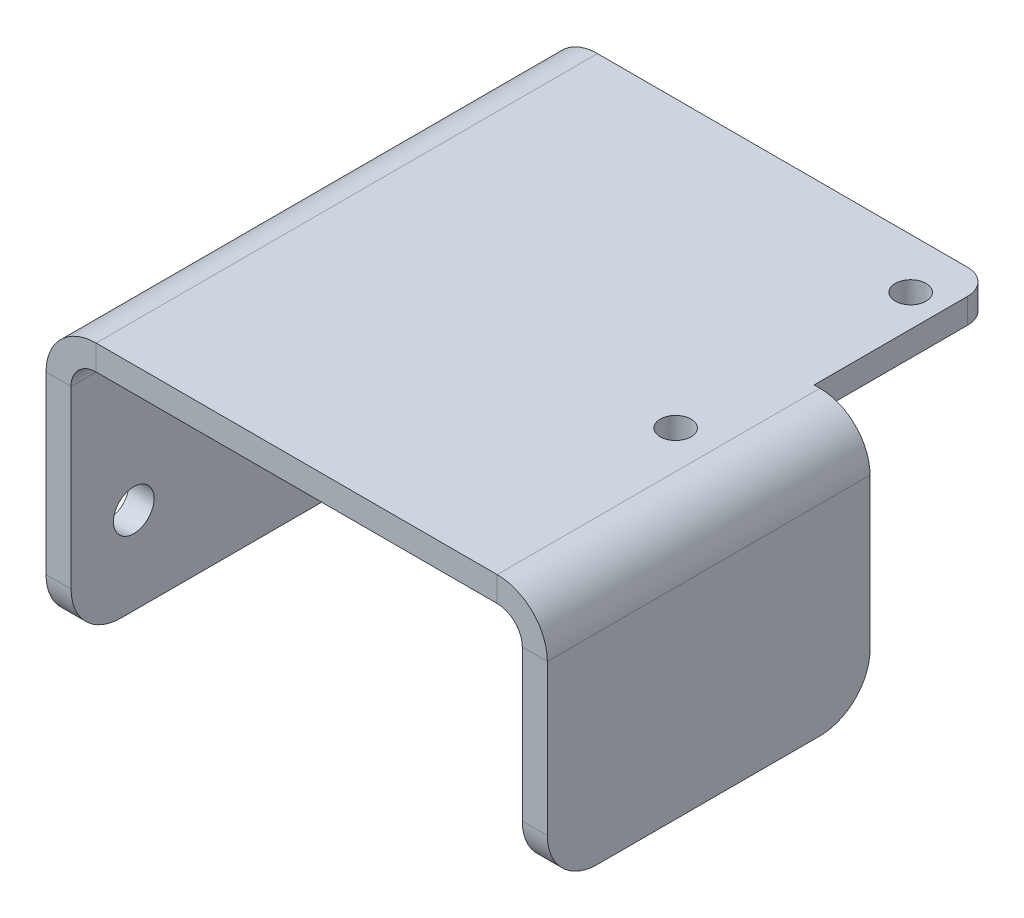
from build123d import *

# Parameters (mm, degrees)
BOSS_EXTRUDE1_DEPTH        = 2
M2_CLEARANCE_HOLE1_D       = 2.459
M3_CLEARANCE_HOLE1_D       = 3.242
SKETCHED_START             = 39.700827994
SKETCHED_BEND1_OUTLINE_W   = 2
SKETCHED_BEND1_OUTLINE_H   = 25.75
SKETCHED_BEND1_DEPTH       = 17.149172006
SKETCHED_START_2           = 36.111787994
SKETCHED_BEND1_2_DEPTH     = 4
SKETCHED_START_3           = -5.75
SKETCHED_BEND1_3_DEPTH     = 25.75
SKETCHED_START_4           = -18.6
SKETCHED_BEND2_OUTLINE_W   = 2
SKETCHED_BEND2_OUTLINE_H   = 40
SKETCHED_BEND2_DEPTH       = 19.122747994
SKETCHED_START_5           = 0.752486697
SKETCHED_BEND2_2_OUTLINE_R = 1.621
SKETCHED_BEND2_2_DEPTH     = 1.359301297
SKETCHED_START_6           = 0.111787994
SKETCHED_BEND2_3_OUTLINE_R = 1.621
SKETCHED_BEND2_3_DEPTH     = 4
SKETCHED_START_7           = -20
SKETCHED_BEND2_4_DEPTH     = 40


with BuildPart() as part:
    # Sketch7 → Boss-Extrude1 (new body)
    with BuildSketch(Plane.XZ):
        with BuildLine():
            Line((35.65, -5.75), (52.85, -5.75))
            ThreePointArc((52.85, -5.75), (55.678427125, -4.578427125), (56.85, -1.75))
            Line((56.85, -1.75), (56.85, 16))
            ThreePointArc((56.85, 16), (55.678427125, 18.828427125), (52.85, 20))
            Line((52.85, 20), (-14.6, 20))
            ThreePointArc((-14.6, 20), (-17.428427125, 18.828427125), (-18.6, 16))
            Line((-18.6, 16), (-18.6, -16))
            ThreePointArc((-18.6, -16), (-17.428427125, -18.828427125), (-14.6, -20))
            Line((-14.6, -20), (33.65, -20))
            ThreePointArc((33.65, -20), (35.064213562, -19.414213562), (35.65, -18))
            Line((35.65, -18), (35.65, -5.75))
        make_face()
    extrude(amount=-BOSS_EXTRUDE1_DEPTH)

    # M2 Clearance Hole1 (through all)
    with Locations(Plane(origin=(0, 0, 0), x_dir=(-1, 0, 0), z_dir=(0, -1, 0))):
        with Locations((-33.1, 16), (-33.1, -2.75)):
            Hole(M2_CLEARANCE_HOLE1_D / 2)

    # M3 Clearance Hole1 (through all)
    with Locations(Plane(origin=(0, 2, 0), x_dir=(1, 0, 0), z_dir=(0, 1, 0))):
        with Locations((-11.65, -15), (-11.65, 15)):
            Hole(M3_CLEARANCE_HOLE1_D / 2)

    # Sketched Bend1: read off the stored shape, not the designer's step
    # Sketched Bend1 outline → Sketched Bend1 (cut)
    with BuildSketch(Plane.YZ.offset(SKETCHED_START)):
        with Locations((1, 7.125)):
            Rectangle(SKETCHED_BEND1_OUTLINE_W, SKETCHED_BEND1_OUTLINE_H)
    extrude(amount=SKETCHED_BEND1_DEPTH, mode=Mode.SUBTRACT)

    # Sketched Bend1 2 outline → Sketched Bend1 2 (add)
    with BuildSketch(Plane.YZ.offset(SKETCHED_START_2)):
        with BuildLine():
            Line((0, 20), (-14.025823026, 20))
            ThreePointArc((-14.025823026, 20), (-16.854250151, 18.828427124), (-18.025823026, 16))
            Line((-18.025823026, 16), (-18.025823026, -1.75))
            ThreePointArc((-18.025823026, -1.75), (-16.854250151, -4.578427124), (-14.025823026, -5.75))
            Line((-14.025823026, -5.75), (0, -5.75))
            Line((0, -5.75), (0, 20))
        make_face()
    extrude(amount=SKETCHED_BEND1_2_DEPTH)

    # Sketched Bend1 3 outline → Sketched Bend1 3 (cut)
    with BuildSketch(Plane.XY.offset(SKETCHED_START_3)):
        with BuildLine():
            ThreePointArc((36.111787994, 2), (38.940215119, 0.828427125), (40.111787994, -2))
            Line((40.111787994, -2), (40.111787994, 0))
            Line((40.111787994, 0), (39.700827994, 0))
            Line((39.700827994, 0), (39.700827994, 2))
            Line((39.700827994, 2), (36.111787994, 2))
        make_face()
        with BuildLine():
            Line((38.111787994, -18.025823026), (38.111787994, -2))
            ThreePointArc((38.111787994, -2), (37.526001556, -0.585786438), (36.111787994, 0))
            Line((36.111787994, 0), (36.111787994, -18.025823026))
            Line((36.111787994, -18.025823026), (38.111787994, -18.025823026))
        make_face()
    extrude(amount=SKETCHED_BEND1_3_DEPTH, mode=Mode.SUBTRACT)

    # Sketched Bend2: read off the stored shape, not the designer's step
    # Sketched Bend2 outline → Sketched Bend2 (cut)
    with BuildSketch(Plane.YZ.offset(SKETCHED_START_4)):
        with Locations((1, 0)):
            Rectangle(SKETCHED_BEND2_OUTLINE_W, SKETCHED_BEND2_OUTLINE_H)
    extrude(amount=SKETCHED_BEND2_DEPTH, mode=Mode.SUBTRACT)

    # Sketched Bend2 2 outline → Sketched Bend2 2 (add)
    with BuildSketch(Plane.YZ.offset(SKETCHED_START_5)):
        with BuildLine():
            Line((0, 20), (-15.999399014, 20))
            ThreePointArc((-15.999399014, 20), (-18.827826139, 18.828427125), (-19.999399014, 16))
            Line((-19.999399014, 16), (-19.999399014, -16))
            ThreePointArc((-19.999399014, -16), (-18.827826139, -18.828427124), (-15.999399014, -20))
            Line((-15.999399014, -20), (0, -20))
            Line((0, -20), (0, 20))
        make_face()
        with Locations((-13.049399014, -15)):
            Circle(SKETCHED_BEND2_2_OUTLINE_R, mode=Mode.SUBTRACT)
        with Locations((-13.049399014, 15)):
            Circle(SKETCHED_BEND2_2_OUTLINE_R, mode=Mode.SUBTRACT)
    extrude(amount=SKETCHED_BEND2_2_DEPTH)

    # Sketched Bend2 3 outline → Sketched Bend2 3 (add)
    with BuildSketch(Plane.YZ.offset(SKETCHED_START_6)):
        with BuildLine():
            Line((0, 20), (-15.999399014, 20))
            ThreePointArc((-15.999399014, 20), (-18.827826139, 18.828427125), (-19.999399014, 16))
            Line((-19.999399014, 16), (-19.999399014, -16))
            ThreePointArc((-19.999399014, -16), (-18.827826139, -18.828427124), (-15.999399014, -20))
            Line((-15.999399014, -20), (0, -20))
            Line((0, -20), (0, 20))
        make_face()
        with Locations((-13.049399014, -15)):
            Circle(SKETCHED_BEND2_3_OUTLINE_R, mode=Mode.SUBTRACT)
        with Locations((-13.049399014, 15)):
            Circle(SKETCHED_BEND2_3_OUTLINE_R, mode=Mode.SUBTRACT)
    extrude(amount=SKETCHED_BEND2_3_DEPTH)

    # Sketched Bend2 4 outline → Sketched Bend2 4 (cut)
    with BuildSketch(Plane.XY.offset(SKETCHED_START_7)):
        with BuildLine():
            Line((0.111787994, 0), (0.111787994, -2))
            ThreePointArc((0.111787994, -2), (1.283360869, 0.828427125), (4.111787994, 2))
            Line((4.111787994, 2), (0.522747994, 2))
            Line((0.522747994, 2), (0.522747994, 0))
            Line((0.522747994, 0), (0.111787994, 0))
        make_face()
        with BuildLine():
            ThreePointArc((4.111787994, 0), (2.697574432, -0.585786438), (2.111787994, -2))
            Line((2.111787994, -2), (2.111787994, -19.999399014))
            Line((2.111787994, -19.999399014), (4.111787994, -19.999399014))
            Line((4.111787994, -19.999399014), (4.111787994, 0))
        make_face()
    extrude(amount=SKETCHED_BEND2_4_DEPTH, mode=Mode.SUBTRACT)


solid = part.part
